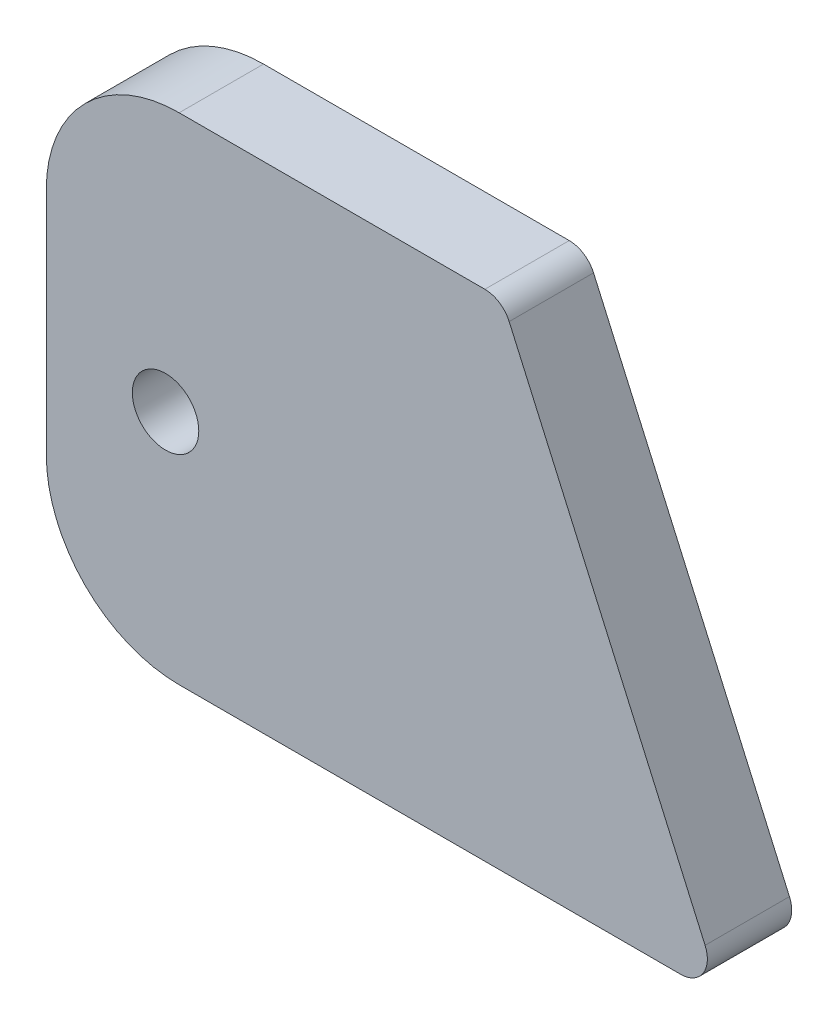
from build123d import *

# Parameters (mm, degrees)
BOSS_EXTRUDE1_DEPTH = 1.5875
FILLET1_R           = 1
FILLET2_R           = 5
SKETCH2_R           = 1.25
CUT_EXTRUDE1_DEPTH  = 17.357137005


with BuildPart() as part:
    # Sketch1 → Boss-Extrude1 (new, symmetric)
    with BuildSketch(Plane.XY):
        Polygon((-11.81540086, 9.32089354), (-11.81540086, -9.32089354), (12.941517766, -9.32089354), (13.597976447, -9.32089354), (5.339733299, 9.32089354), (4.683274618, 9.32089354), align=None)
    extrude(amount=BOSS_EXTRUDE1_DEPTH, both=True)

    # Fillet1
    fillet1_edges = [part.edges().sort_by_distance(p)[0] for p in [
        (13.597976447, -9.32089354, 0),
        (5.339733299, 9.32089354, 0),
    ]]
    fillet(fillet1_edges, radius=FILLET1_R)

    # Fillet2
    fillet2_edges = [part.edges().sort_by_distance(p)[0] for p in [
        (-11.81540086, 9.32089354, 0),
        (-11.81540086, -9.32089354, 0),
    ]]
    fillet(fillet2_edges, radius=FILLET2_R)

    # Sketch2 → Cut-Extrude1 (cut, through all)
    with BuildSketch(Plane.XY.offset(1.5875)):
        with Locations((-7.3274835, -0.67910646)):
            Circle(SKETCH2_R)
    extrude(amount=-CUT_EXTRUDE1_DEPTH, mode=Mode.SUBTRACT)


solid = part.part
